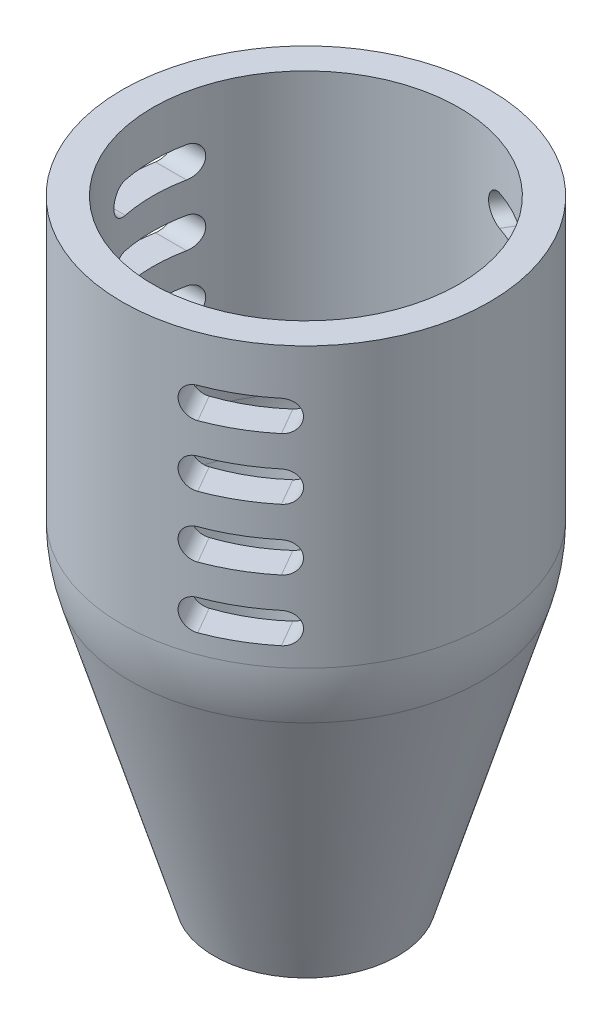
from build123d import *

# Parameters (mm, degrees)
CORTAR_EXTRUIR2_DEPTH = 61
MATRIZC1_COUNT        = 3


# Read off the part's stored shape, not the designer's step: Vaciado2
with BuildPart() as part:
    # Croquis2 → Revolución3 (revolve)
    with BuildSketch(Plane.XY, mode=Mode.PRIVATE) as revoluci_n3_sk:
        with BuildLine():
            Line((0, 0), (15, 0))
            Line((15, 0), (28.734788557, 45.782628522))
            ThreePointArc((28.734788557, 45.782628522), (29.682011865, 50.046670749), (30, 54.403065089))
            Line((30, 54.403065089), (30, 100))
            Line((30, 100), (0, 100))
            Line((0, 100), (0, 0))
        make_face()
    revolve(revoluci_n3_sk.sketch.rotate(Axis((0, 100, 0), (0, -1, 0)), 180), axis=Axis((0, 100, 0), (0, -1, 0)))

    # Vaciado2 outline → Vaciado2 (revolve, cut)
    with BuildSketch(Plane.XY):
        with BuildLine():
            Line((0, 100), (0, 10))
            Line((0, 10), (12.779846746, 10))
            Line((12.779846746, 10), (23.945657123, 47.219367926))
            ThreePointArc((23.945657123, 47.219367926), (24.735009887, 50.772736472), (25, 54.403065114))
            Line((25, 54.403065114), (25, 100))
            Line((25, 100), (0, 100))
        make_face()
    revolve(axis=Axis((0, 0, 0), (0, 1, 0)), mode=Mode.SUBTRACT)

    # Croquis3 → Cortar-Extruir2 (cut)
    with BuildSketch(Plane(origin=(0, 0, 0), x_dir=(0, 0, -1), z_dir=(1, 0, 0))):
        with BuildLine():
            Line((-5, 62.5), (5, 62.5))
            ThreePointArc((5, 62.5), (7.5, 60), (5, 57.5))
            Line((5, 57.5), (-5, 57.5))
            ThreePointArc((-5, 57.5), (-7.5, 60), (-5, 62.5))
        make_face()
        with BuildLine():
            Line((-5, 72.5), (5, 72.5))
            ThreePointArc((5, 72.5), (7.5, 70), (5, 67.5))
            Line((5, 67.5), (-5, 67.5))
            ThreePointArc((-5, 67.5), (-7.5, 70), (-5, 72.5))
        make_face()
        with BuildLine():
            Line((-5, 82.5), (5, 82.5))
            ThreePointArc((5, 82.5), (7.5, 80), (5, 77.5))
            Line((5, 77.5), (-5, 77.5))
            ThreePointArc((-5, 77.5), (-7.5, 80), (-5, 82.5))
        make_face()
        with BuildLine():
            Line((-5, 92.5), (5, 92.5))
            ThreePointArc((5, 92.5), (7.5, 90), (5, 87.5))
            Line((5, 87.5), (-5, 87.5))
            ThreePointArc((-5, 87.5), (-7.5, 90), (-5, 92.5))
        make_face()
    cortar_extruir2 = extrude(amount=-CORTAR_EXTRUIR2_DEPTH, mode=Mode.SUBTRACT)

    # MatrizC1: Cortar-Extruir2 ×3 about axis
    matrizc1_axis = Axis((0, 100, 0), (0, 1, 0))
    for i in range(1, MATRIZC1_COUNT):
        add(cortar_extruir2.rotate(matrizc1_axis, i * 360 / MATRIZC1_COUNT), mode=Mode.SUBTRACT)


solid = part.part
